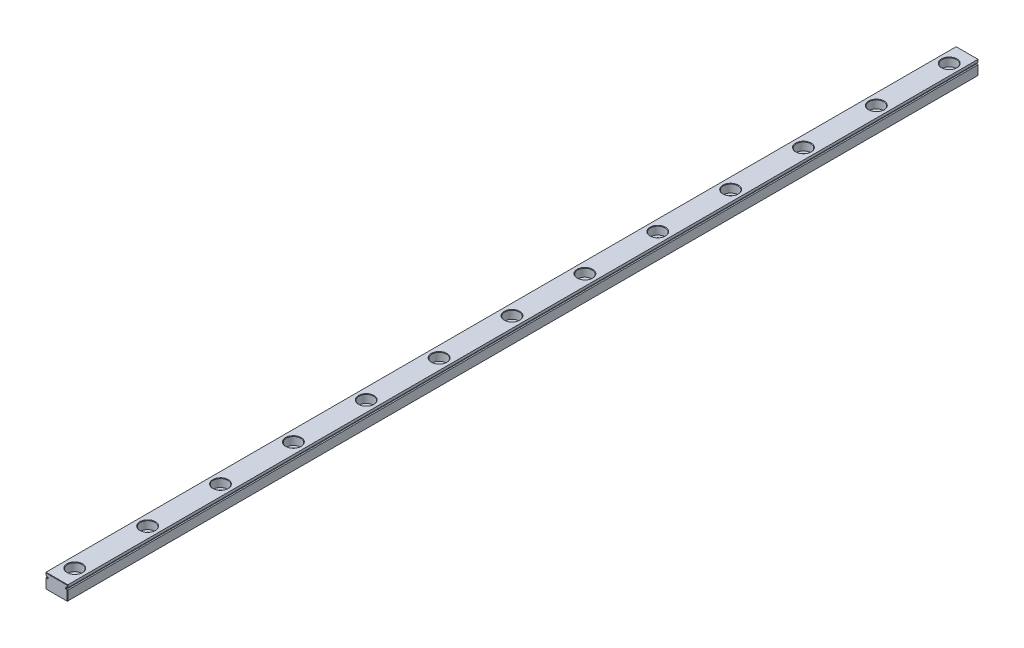
from build123d import *

# Parameters (mm, degrees)
BOSS_EXTRUDE1_DEPTH = 500
CHAMFER1_SIZE       = 0.2
LPATTERN1_COUNT     = 13
LPATTERN1_PITCH     = 40


with BuildPart() as part:
    # Sketch1 → Boss-Extrude1 (new body)
    with BuildSketch(Plane.XY):
        with BuildLine():
            Line((12.21524152, 8.978261926), (12.21524152, 7.53727892))
            ThreePointArc((12.21524152, 7.53727892), (11.921348894, 7.453790184), (11.71524152, 7.228261926))
            Line((11.71524152, 7.228261926), (11.21524152, 7.228261926))
            Line((11.21524152, 7.228261926), (11.21524152, 6.728261926))
            Line((11.21524152, 6.728261926), (11.71524152, 6.728261926))
            ThreePointArc((11.71524152, 6.728261926), (11.921348894, 6.502733668), (12.21524152, 6.419244931))
            Line((12.21524152, 6.419244931), (12.21524152, 1.278261926))
            Line((12.21524152, 1.278261926), (11.91524152, 0.978261926))
            Line((11.91524152, 0.978261926), (0.51524152, 0.978261926))
            Line((0.51524152, 0.978261926), (0.21524152, 1.278261926))
            Line((0.21524152, 1.278261926), (0.21524152, 6.419244931))
            ThreePointArc((0.21524152, 6.419244931), (0.509134147, 6.502733668), (0.71524152, 6.728261926))
            Line((0.71524152, 6.728261926), (1.21524152, 6.728261926))
            Line((1.21524152, 6.728261926), (1.21524152, 7.228261926))
            Line((1.21524152, 7.228261926), (0.71524152, 7.228261926))
            ThreePointArc((0.71524152, 7.228261926), (0.509134147, 7.453790184), (0.21524152, 7.53727892))
            Line((0.21524152, 7.53727892), (0.21524152, 8.978261926))
            Line((0.21524152, 8.978261926), (12.21524152, 8.978261926))
        make_face()
    extrude(amount=-BOSS_EXTRUDE1_DEPTH)

    # Chamfer1
    chamfer1_edges = [part.edges().sort_by_distance(p)[0] for p in [
        (0.21524152, 8.257770423, 0),
        (0.509134147, 7.453790184, 0),
        (0.96524152, 7.228261926, 0),
        (1.21524152, 6.978261926, 0),
        (0.96524152, 6.728261926, 0),
        (0.509134147, 6.502733668, 0),
        (0.21524152, 3.848753429, 0),
        (0.36524152, 1.128261926, 0),
        (6.21524152, 0.978261926, 0),
        (12.06524152, 1.128261926, 0),
        (12.21524152, 3.848753429, 0),
        (11.921348894, 6.502733668, 0),
        (11.46524152, 6.728261926, 0),
        (11.21524152, 6.978261926, 0),
        (11.46524152, 7.228261926, 0),
        (11.921348894, 7.453790184, 0),
        (12.21524152, 8.257770423, 0),
        (6.21524152, 8.978261926, 0),
        (11.921348894, 6.502733668, -500),
        (11.46524152, 6.728261926, -500),
        (11.21524152, 6.978261926, -500),
        (11.46524152, 7.228261926, -500),
        (11.921348894, 7.453790184, -500),
        (12.21524152, 8.257770423, -500),
        (12.21524152, 3.848753429, -500),
        (12.06524152, 1.128261926, -500),
        (6.21524152, 0.978261926, -500),
        (0.36524152, 1.128261926, -500),
        (0.21524152, 3.848753429, -500),
        (0.509134147, 6.502733668, -500),
        (0.96524152, 6.728261926, -500),
        (1.21524152, 6.978261926, -500),
        (0.96524152, 7.228261926, -500),
        (0.509134147, 7.453790184, -500),
        (0.21524152, 8.257770423, -500),
        (6.21524152, 8.978261926, -500),
    ]]
    chamfer(chamfer1_edges, length=CHAMFER1_SIZE)

    # Sketch3 → CBORE for M4 Hex Head Machine Screw1 (revolve, cut)
    with BuildSketch(Plane(origin=(6.21524152, 8.978261926, -10), x_dir=(0, 0, 1), z_dir=(1, 0, 0))):
        Polygon((0, 0), (0, 8), (2.25, 8), (2.25, 4.5), (4, 4.5), (4, 0.25), (4.25, 0), align=None)
    cbore_for_m4_hex_head_machine_screw1 = revolve(axis=Axis((6.21524152, 15.328261926, -10), (0, -1, 0)), mode=Mode.SUBTRACT)

    # LPattern1: CBORE for M4 Hex Head Machine Screw1 ×13
    with Locations(*[(0, 0, -i * LPATTERN1_PITCH) for i in range(1, LPATTERN1_COUNT)]):
        add(cbore_for_m4_hex_head_machine_screw1, mode=Mode.SUBTRACT)


solid = part.part
